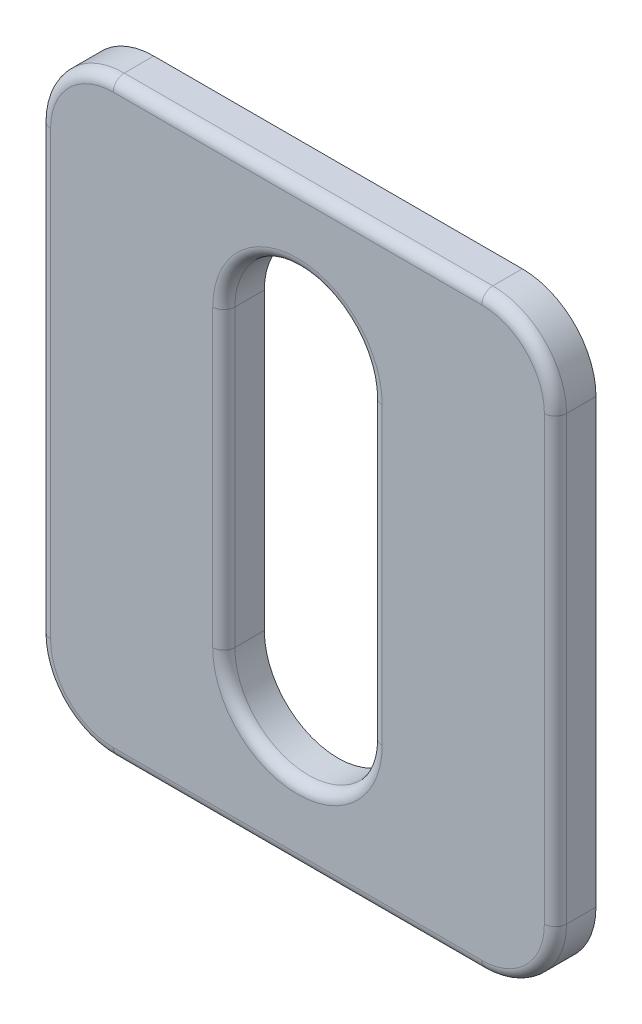
from build123d import *

# Parameters (mm, degrees)
SKETCH1_W           = 35
SKETCH1_H           = 40
BOSS_EXTRUDE1_DEPTH = 2.75
FILLET1_R           = 5
FILLET2_R           = 0.75


with BuildPart() as part:
    # Sketch1 → Boss-Extrude1 (new body)
    with BuildSketch(Plane.XY):
        with Locations((17.5, 20)):
            Rectangle(SKETCH1_W, SKETCH1_H)
        with BuildLine():
            Line((22.5, 30), (22.5, 10))
            ThreePointArc((22.5, 10), (17.5, 5), (12.5, 10))
            Line((12.5, 10), (12.5, 30))
            ThreePointArc((12.5, 30), (17.5, 35), (22.5, 30))
        make_face(mode=Mode.SUBTRACT)
    extrude(amount=BOSS_EXTRUDE1_DEPTH)

    # Fillet1
    fillet1_edges = [part.edges().sort_by_distance(p)[0] for p in [
        (35, 40, 1.375),
        (35, 0, 1.375),
        (0, 0, 1.375),
        (0, 40, 1.375),
    ]]
    fillet(fillet1_edges, radius=FILLET1_R)

    # Fillet2
    fillet2_edges = [part.edges().sort_by_distance(p)[0] for p in [
        (1.464466094, 1.464466094, 2.75),
        (0, 20, 2.75),
        (1.464466094, 38.535533906, 2.75),
        (33.535533906, 38.535533906, 2.75),
        (17.5, 40, 2.75),
        (35, 20, 2.75),
        (33.535533906, 1.464466094, 2.75),
        (17.5, 0, 2.75),
        (17.5, 5, 2.75),
        (22.5, 20, 2.75),
        (17.5, 35, 2.75),
        (12.5, 20, 2.75),
    ]]
    fillet(fillet2_edges, radius=FILLET2_R)


solid = part.part
